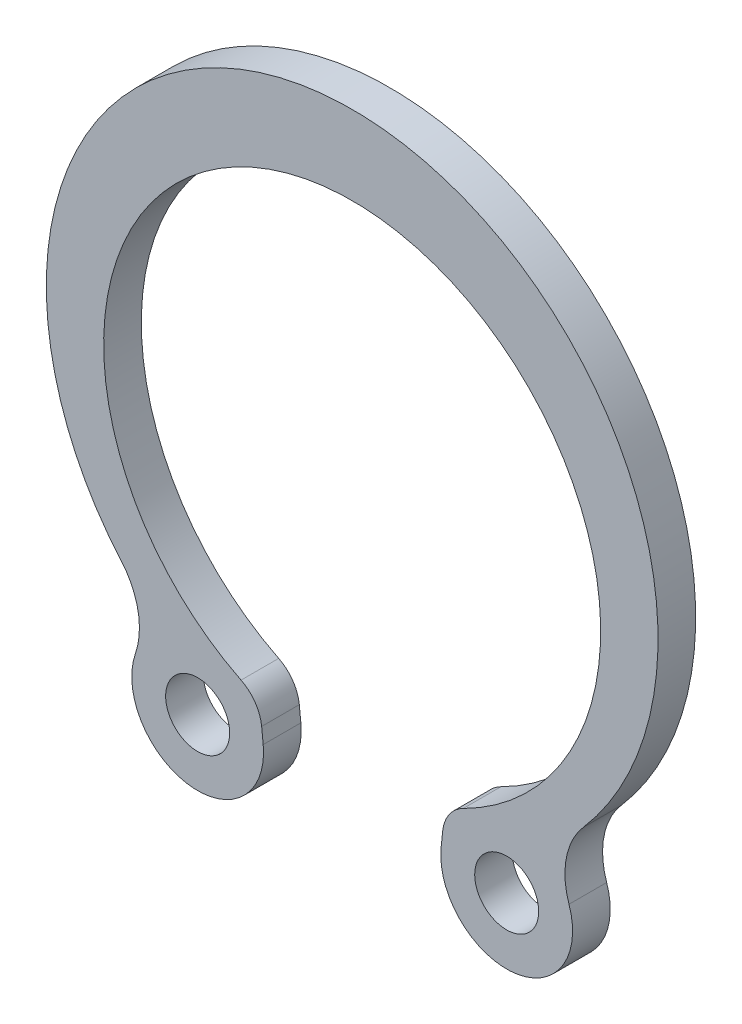
from build123d import *

# Parameters (mm, degrees)
SKETCH_2_R      = 0.85
EXTRUDE_1_DEPTH = 1


with BuildPart() as part:
    # Эскиз2 → Бобышка-Вытянуть1 (new body)
    with BuildSketch(Plane.XY):
        with BuildLine():
            Line((0, 6.6), (0, 8.7))
            ThreePointArc((0, 8.7), (-7.389235266, 3.950983676), (-6.13857237, -4.743255577))
            ThreePointArc((-6.13857237, -4.743255577), (-5.68651404, -5.672432693), (-5.758558899, -6.703226748))
            ThreePointArc((-5.758558899, -6.703226748), (-4.302476841, -9.010733841), (-2.362917299, -7.091652622))
            Line((-2.362917299, -7.091652622), (-2.404001769, -6.6947518))
            ThreePointArc((-2.404001769, -6.6947518), (-2.576274335, -6.228823382), (-2.9514913, -5.903278674))
            ThreePointArc((-2.9514913, -5.903278674), (-6.423458541, 1.516304843), (0, 6.6))
        make_face()
        with Locations((-4.10359212, -7.272072037)):
            Circle(SKETCH_2_R, mode=Mode.SUBTRACT)
    extrude(amount=EXTRUDE_1_DEPTH)

    # Зеркальное отражение1: part across plane


with BuildPart() as part_1:
    add(part.part)
    add(part.part.mirror(Plane(origin=(0, 6.6, 1), x_dir=(0, 0, 1), z_dir=(-1, 0, 0))))


solid = part_1.part
